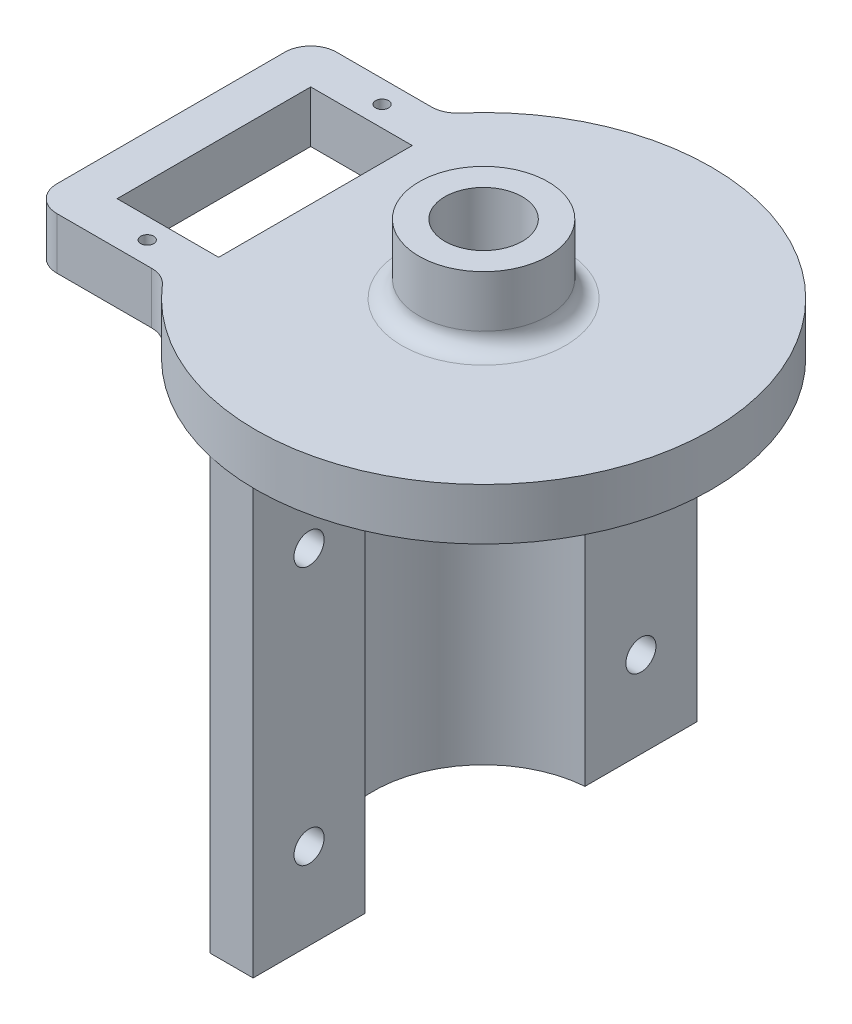
from build123d import *

# Parameters (mm, degrees)
BOSS_EXTRUDE4_DEPTH = 50
SKETCH7_R           = 1.75
CUT_EXTRUDE1_DEPTH  = 59.719147195
SKETCH8_R           = 0.75
SKETCH8_W           = 11.8
SKETCH8_H           = 22.5
BOSS_EXTRUDE5_DEPTH = 6
SKETCH9_R           = 7.5
BOSS_EXTRUDE6_DEPTH = 8
FILLET1_R           = 2
SKETCH10_R          = 4.5
CUT_EXTRUDE2_DEPTH  = 79.215829027


with BuildPart() as part:
    # Sketch6 → Boss-Extrude4 (new body)
    with BuildSketch(Plane.XZ):
        with BuildLine():
            Line((-1, 25.784833184), (-1, 12.785954208))
            ThreePointArc((-1, 12.785954208), (-12.825, 0), (-1, -12.785954208))
            Line((-1, -12.785954208), (-1, -25.784833184))
            Line((-1, -25.784833184), (-6, -25.784833184))
            Line((-6, -25.784833184), (-6, -16.784833184))
            ThreePointArc((-6, -16.784833184), (-17.825, 0), (-6, 16.784833184))
            Line((-6, 16.784833184), (-6, 25.784833184))
            Line((-6, 25.784833184), (-1, 25.784833184))
        make_face()
    extrude(amount=BOSS_EXTRUDE4_DEPTH)

    # Sketch7 → Cut-Extrude1 (cut, through all)
    with BuildSketch(Plane(origin=(-1, 0, 0), x_dir=(0, 0, -1), z_dir=(1, 0, 0))):
        with Locations((-19.285393696, -10)):
            Circle(SKETCH7_R)
        with Locations((-19.285393696, -40)):
            Circle(SKETCH7_R)
        with Locations((19.285393696, -40)):
            Circle(SKETCH7_R)
        with Locations((19.285393696, -10)):
            Circle(SKETCH7_R)
    extrude(amount=-CUT_EXTRUDE1_DEPTH, mode=Mode.SUBTRACT)

    # Sketch8 → Boss-Extrude5 (add)
    with BuildSketch(Plane(origin=(0, 0, 0), x_dir=(1, 0, 0), z_dir=(0, 1, 0))):
        with BuildLine():
            Line((-33.34361413, -16.25), (-22.318992281, -16.25))
            ThreePointArc((-22.318992281, -16.25), (-21.069616181, -16.522536094), (-20.047240136, -17.290627093))
            ThreePointArc((-20.047240136, -17.290627093), (26.473715688, 0), (-20.047240136, 17.290627093))
            ThreePointArc((-20.047240136, 17.290627093), (-21.069616181, 16.522536094), (-22.318992281, 16.25))
            Line((-22.318992281, 16.25), (-33.34361413, 16.25))
            ThreePointArc((-33.34361413, 16.25), (-35.464934474, 15.371320344), (-36.34361413, 13.25))
            Line((-36.34361413, 13.25), (-36.34361413, -13.25))
            ThreePointArc((-36.34361413, -13.25), (-35.464934474, -15.371320344), (-33.34361413, -16.25))
        make_face()
        with Locations((-25.44361413, 13.65)):
            Circle(SKETCH8_R, mode=Mode.SUBTRACT)
        with Locations((-25.44361413, -13.65)):
            Circle(SKETCH8_R, mode=Mode.SUBTRACT)
        with Locations((-25.44361413, 0)):
            Rectangle(SKETCH8_W, SKETCH8_H, mode=Mode.SUBTRACT)
    extrude(amount=BOSS_EXTRUDE5_DEPTH)

    # Sketch9 → Boss-Extrude6 (add)
    with BuildSketch(Plane(origin=(0, 6, 0), x_dir=(1, 0, 0), z_dir=(0, 1, 0))):
        Circle(SKETCH9_R)
    extrude(amount=BOSS_EXTRUDE6_DEPTH)

    # Fillet1
    fillet1_edges = [part.edges().sort_by_distance(p)[0] for p in [
        (-7.5, 6, 0),
    ]]
    fillet(fillet1_edges, radius=FILLET1_R)

    # Sketch10 → Cut-Extrude2 (cut, through all)
    with BuildSketch(Plane(origin=(0, 14, 0), x_dir=(1, 0, 0), z_dir=(0, 1, 0))):
        Circle(SKETCH10_R)
    extrude(amount=-CUT_EXTRUDE2_DEPTH, mode=Mode.SUBTRACT)


solid = part.part
